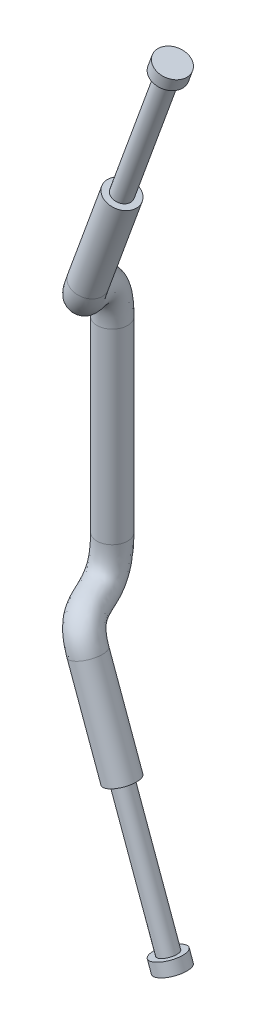
from build123d import *

# Parameters (mm, degrees)
SKETCH2_R               = 12.5
BOSS_EXTRUDE1_DEPTH     = 10
SKETCH2_3_R             = 7.5
BOSS_EXTRUDE2_DEPTH     = 110
BOSS_EXTRUDE3_START     = -190
SKETCH2_4_R             = 12.5
BOSS_EXTRUDE3_DEPTH     = 80
SKETCH3_R               = 12.5
BOSS_EXTRUDE5_DEPTH     = 75
SKETCH7_R               = 12.5
CUT_EXTRUDE1_DEPTH      = 343.935736623
CUT_EXTRUDE1_DEPTH_BACK = 343.935736623
SKETCH8_W               = 400
SKETCH8_H               = 250


with BuildPart() as part:
    # Sketch2 → Boss-Extrude1 (new body)
    with BuildSketch(Plane(origin=(85.505035831, -309.923155196, 0), x_dir=(0.9396926207859104, 0.3420201433256633, 0), z_dir=(0.3420201433256633, -0.9396926207859104, 0))):
        Circle(SKETCH2_R)
    extrude(amount=BOSS_EXTRUDE1_DEPTH)

    # Sketch2<3> → Boss-Extrude2 (add)
    with BuildSketch(Plane(origin=(85.505035831, -309.923155196, 0), x_dir=(0.9396926207859104, 0.3420201433256633, 0), z_dir=(0.3420201433256633, -0.9396926207859104, 0))):
        Circle(SKETCH2_3_R)
    extrude(amount=-BOSS_EXTRUDE2_DEPTH)

    # Sketch2<4> → Boss-Extrude3 (add)
    with BuildSketch(Plane(origin=(85.505035831, -309.923155196, 0), x_dir=(0.9396926207859104, 0.3420201433256633, 0), z_dir=(0.3420201433256633, -0.9396926207859104, 0)).offset(BOSS_EXTRUDE3_START)):
        Circle(SKETCH2_4_R)
    extrude(amount=BOSS_EXTRUDE3_DEPTH)


with BuildPart() as body_2:
    # Mirror1: mirrored copy
    add(part.part.mirror(Plane.ZX))



with BuildPart() as body_3:
    # Sketch3 → Boss-Extrude5 (new, symmetric)
    with BuildSketch(Plane(origin=(0, 0, 0), x_dir=(-1, 0, 0), z_dir=(0, 1, 0))):
        with Locations(Location((0, -40, 0), (0, 0, 90))):
            Circle(SKETCH3_R)
    extrude(amount=BOSS_EXTRUDE5_DEPTH, both=True)


with BuildPart() as body_2_1:
    add(body_2.part)

    add(body_3.part)  # Sweep3 merges body 3
    # Sweep3: sweep along a curve in space
    with BuildLine() as sweep3_path:
        Line((20.5212086, 131.381557247, 0), (20.179188456, 130.441864626, 0))
        add(Edge.make_bspline(
            [(20.179188456, 130.441864626, 0), (7.274699912, 94.987073742, 0), (0, 128.736158289, -40), (0, 76, -40)],
            knots=[0, 0, 0, 0, 1, 1, 1, 1], degree=3))
        Line((0, 75, -40), (0, 76, -40))
    # Sketch7 → Sweep3 (sweep)
    with BuildSketch(Plane(origin=(44.625743963, 122.608223864, 0), x_dir=(0.9396926207859105, -0.34202014332566305, 0), z_dir=(-0.342020143325663, -0.9396926207859104, 0))):
        with Locations((-25.651510749, 0)):
            Circle(SKETCH7_R)
    sweep3 = sweep(path=sweep3_path.line)

    # Mirror2: Sweep3 across plane
    add(sweep3.mirror(Plane.ZX))


with BuildPart() as cut_extrude1_tool:
    # Sketch8 → Cut-Extrude1 (new, two sides: drawn at the far end of the back side and taken through both)
    with BuildSketch(Plane(origin=(0, 0, 0), x_dir=(0, 1, 0), z_dir=(0, 0, 1)).offset(-CUT_EXTRUDE1_DEPTH_BACK)):
        with Locations((-200, -25)):
            Rectangle(SKETCH8_W, SKETCH8_H)
    extrude(amount=CUT_EXTRUDE1_DEPTH + CUT_EXTRUDE1_DEPTH_BACK)


with BuildPart() as part_1:
    add(part.part)

    # Cut-Extrude1: cut by cut_extrude1_tool
    add(cut_extrude1_tool.part, mode=Mode.SUBTRACT)


with BuildPart() as body_2_2:
    add(body_2_1.part)

    # Cut-Extrude1: cut by cut_extrude1_tool
    add(cut_extrude1_tool.part, mode=Mode.SUBTRACT)

    # Mirror3: body 2 across plane


with BuildPart() as body_2_3:
    add(body_2_2.part)
    add(body_2_2.part.mirror(Plane(origin=(-100, 0, -53.963311936), x_dir=(0, 0, 1), z_dir=(0, 1, 0))))


solid = body_2_3.part
